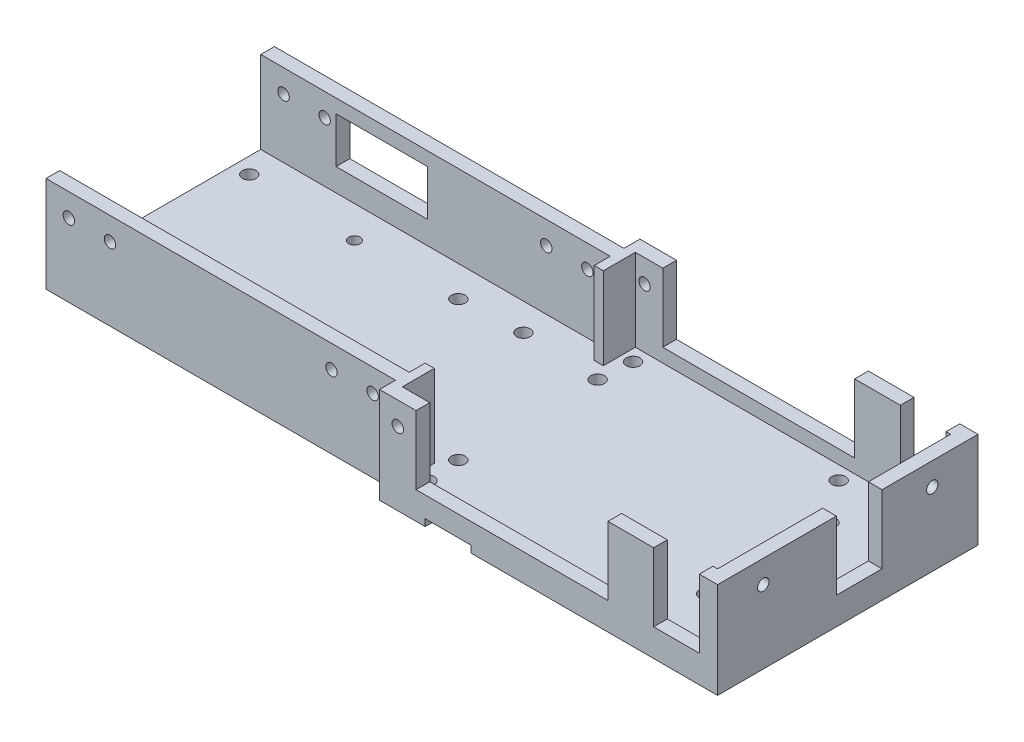
from build123d import *

# Parameters (mm, degrees)
SKETCH1_W           = 150.5
SKETCH1_H           = 50
BOSS_EXTRUDE1_DEPTH = 3
SKETCH2_R           = 1.5
SKETCH2_R_2         = 1.25
CUT_EXTRUDE1_DEPTH  = 119.536164414
SKETCH4_W           = 74
SKETCH4_H           = 3.5
BOSS_EXTRUDE2_DEPTH = 3
SKETCH5_R           = 1.5
CUT_EXTRUDE3_DEPTH  = 120.414015588
SKETCH6_W           = 10
SKETCH6_H           = 3
BOSS_EXTRUDE3_DEPTH = 18
SKETCH8_W           = 10
SKETCH8_H           = 3
SKETCH8_H_2         = 2
SKETCH8_W_2         = 42
SKETCH8_W_3         = 3
SKETCH8_H_3         = 10
BOSS_EXTRUDE4_DEPTH = 3
CUT_EXTRUDE4_REACH  = 130.67
SKETCH9_W           = 20
SKETCH9_H           = 10
CUT_EXTRUDE5_REACH  = 157.207
SKETCH10_R          = 1.25
SKETCH11_R          = 1.25
CUT_EXTRUDE6_DEPTH  = 129.67006369
SKETCH12_R          = 1.25
CUT_EXTRUDE7_DEPTH  = 131.164262722
SKETCH13_W          = 10
SKETCH13_H          = 1.5
CUT_EXTRUDE8_DEPTH  = 1.5


with BuildPart() as part:
    # Sketch1 → Boss-Extrude1 (new body)
    with BuildSketch(Plane(origin=(0, 0, 0), x_dir=(1, 0, 0), z_dir=(0, 1, 0))):
        with Locations((-39.87052506, -3.090692124)):
            Rectangle(SKETCH1_W, SKETCH1_H)
    extrude(amount=BOSS_EXTRUDE1_DEPTH)

    # Sketch2 → Cut-Extrude1 (cut, through all)
    with BuildSketch(Plane(origin=(0, 3, 0), x_dir=(1, 0, 0), z_dir=(0, 1, 0))):
        with Locations((-65.12052506, 12.159307876)):
            Circle(SKETCH2_R)
        with Locations((-65.12052506, -18.340692124)):
            Circle(SKETCH2_R)
        with Locations((-34.62052506, -18.340692124)):
            Circle(SKETCH2_R)
        with Locations((-34.62052506, 12.159307876)):
            Circle(SKETCH2_R)
        with Locations((17.87947494, -16.590692124)):
            Circle(SKETCH2_R)
        with Locations((17.87947494, 10.409307876)):
            Circle(SKETCH2_R)
        with Locations((-111.62052506, -19.090692124)):
            Circle(SKETCH2_R)
        with Locations((-111.62052506, 12.909307876)):
            Circle(SKETCH2_R)
        with Locations((-87.62052506, 11.909307876)):
            Circle(SKETCH2_R_2)
        with Locations((-87.62052506, -18.090692124)):
            Circle(SKETCH2_R_2)
        with Locations((-51.62052506, 12.909307876)):
            Circle(SKETCH2_R)
        with Locations((-51.62052506, -19.090692124)):
            Circle(SKETCH2_R)
    extrude(amount=-CUT_EXTRUDE1_DEPTH, mode=Mode.SUBTRACT)

    # Sketch4 → Boss-Extrude2 (add)
    with BuildSketch(Plane(origin=(0, 3, 0), x_dir=(1, 0, 0), z_dir=(0, 1, 0))):
        with Locations((-1.62052506, 23.659307876)):
            Rectangle(SKETCH4_W, SKETCH4_H)
        with Locations((-1.62052506, -29.840692124)):
            Rectangle(SKETCH4_W, SKETCH4_H)
    extrude(amount=-BOSS_EXTRUDE2_DEPTH)

    # Sketch5 → Cut-Extrude3 (cut, through all)
    with BuildSketch(Plane(origin=(0, 3, 0), x_dir=(1, 0, 0), z_dir=(0, 1, 0))):
        with Locations((-34.12052506, 19.409307876)):
            Circle(SKETCH5_R)
        with Locations((-34.12052506, -25.590692124)):
            Circle(SKETCH5_R)
        with Locations((10.87947494, 19.409307876)):
            Circle(SKETCH5_R)
        with Locations((10.87947494, -25.590692124)):
            Circle(SKETCH5_R)
    extrude(amount=-CUT_EXTRUDE3_DEPTH, mode=Mode.SUBTRACT)

    # Sketch6 → Boss-Extrude3 (add)
    with BuildSketch(Plane(origin=(0, 3, 0), x_dir=(1, 0, 0), z_dir=(0, 1, 0))):
        Polygon((35.37947494, -5.590692124), (32.37947494, -5.590692124), (32.37947494, -28.590692124), (31.37947494, -28.590692124), (31.37947494, -31.590692124), (35.37947494, -31.590692124), align=None)
        Polygon((35.37947494, 25.409307876), (31.37947494, 25.409307876), (31.37947494, 22.409307876), (32.37947494, 22.409307876), (32.37947494, 4.409307876), (35.37947494, 4.409307876), align=None)
        Polygon((-30.62052506, 22.409307876), (-30.62052506, 25.409307876), (-38.62052506, 25.409307876), (-38.62052506, 21.909307876), (-115.12052506, 21.909307876), (-115.12052506, 18.909307876), (-38.62052506, 18.909307876), (-38.62052506, 15.409307876), (-36.62052506, 15.409307876), (-36.62052506, 22.409307876), align=None)
        with Locations((16.37947494, 23.909307876)):
            Rectangle(SKETCH6_W, SKETCH6_H)
        Polygon((-36.62052506, -21.590692124), (-38.62052506, -21.590692124), (-38.62052506, -25.090692124), (-115.12052506, -25.090692124), (-115.12052506, -28.090692124), (-38.62052506, -28.090692124), (-38.62052506, -31.590692124), (-30.62052506, -31.590692124), (-30.62052506, -28.590692124), (-36.62052506, -28.590692124), align=None)
        with Locations((16.37947494, -30.090692124)):
            Rectangle(SKETCH6_W, SKETCH6_H)
    extrude(amount=BOSS_EXTRUDE3_DEPTH)

    # Sketch8 → Boss-Extrude4 (add)
    with BuildSketch(Plane(origin=(0, 3, 0), x_dir=(1, 0, 0), z_dir=(0, 1, 0))):
        with Locations((26.37947494, -30.090692124)):
            Rectangle(SKETCH8_W, SKETCH8_H)
        with Locations((26.37947494, 24.409307876)):
            Rectangle(SKETCH8_W, SKETCH8_H_2)
        with Locations((-9.62052506, 23.909307876)):
            Rectangle(SKETCH8_W_2, SKETCH8_H)
        with Locations((-9.62052506, -30.090692124)):
            Rectangle(SKETCH8_W_2, SKETCH8_H)
        with Locations((33.87947494, -0.590692124)):
            Rectangle(SKETCH8_W_3, SKETCH8_H_3)
    extrude(amount=BOSS_EXTRUDE4_DEPTH)

    # Sketch9 → Cut-Extrude4 (cut, up to next)
    with BuildSketch(Plane(origin=(0, 0, -21.909307876), x_dir=(-1, 0, 0), z_dir=(0, 0, -1)), mode=Mode.PRIVATE) as cut_extrude4_sk1:
        with Locations((88.62052506, 13)):
            Rectangle(SKETCH9_W, SKETCH9_H)
    cut_extrude4_tool1 = extrude(cut_extrude4_sk1.sketch, amount=-CUT_EXTRUDE4_REACH, mode=Mode.PRIVATE) & part.part
    add(cut_extrude4_tool1.solids().sort_by_distance((-88.620525, 13, -21.909308))[0], mode=Mode.SUBTRACT)

    # Sketch10 → Cut-Extrude5 (cut, up to next)
    with BuildSketch(Plane(origin=(35.37947494, 0, 0), x_dir=(0, 0, -1), z_dir=(1, 0, 0)), mode=Mode.PRIVATE) as cut_extrude5_sk1:
        with Locations((-21.590692124, 16)):
            Circle(SKETCH10_R)
    cut_extrude5_tool1 = extrude(cut_extrude5_sk1.sketch, amount=-CUT_EXTRUDE5_REACH, mode=Mode.PRIVATE) & part.part
    # Sketch10 → Cut-Extrude5 (cut, up to next)
    with BuildSketch(Plane(origin=(35.37947494, 0, 0), x_dir=(0, 0, -1), z_dir=(1, 0, 0)), mode=Mode.PRIVATE) as cut_extrude5_sk2:
        with Locations((15.409307876, 16)):
            Circle(SKETCH10_R)
    cut_extrude5_tool2 = extrude(cut_extrude5_sk2.sketch, amount=-CUT_EXTRUDE5_REACH, mode=Mode.PRIVATE) & part.part
    add(cut_extrude5_tool1.solids().sort_by_distance((35.379475, 16, 21.590692))[0], mode=Mode.SUBTRACT)
    add(cut_extrude5_tool2.solids().sort_by_distance((35.379475, 16, -15.409308))[0], mode=Mode.SUBTRACT)

    # Sketch11 → Cut-Extrude6 (cut, through all)
    with BuildSketch(Plane(origin=(0, 0, -21.909307876), x_dir=(-1, 0, 0), z_dir=(0, 0, -1))):
        with Locations((43.62052506, 16)):
            Circle(SKETCH11_R)
        with Locations((110.12052506, 16)):
            Circle(SKETCH11_R)
        with Locations((52.62052506, 16)):
            Circle(SKETCH11_R)
        with Locations((101.12052506, 16)):
            Circle(SKETCH11_R)
    extrude(amount=-CUT_EXTRUDE6_DEPTH, mode=Mode.SUBTRACT)

    # Sketch12 → Cut-Extrude7 (cut, through all)
    with BuildSketch(Plane(origin=(0, 0, -25.409307876), x_dir=(-1, 0, 0), z_dir=(0, 0, -1))):
        with Locations((34.62052506, 16)):
            Circle(SKETCH12_R)
    extrude(amount=-CUT_EXTRUDE7_DEPTH, mode=Mode.SUBTRACT)

    # Sketch13 → Cut-Extrude8 (cut)
    with BuildSketch(Plane(origin=(0, 0, 0), x_dir=(-1, 0, 0), z_dir=(0, -1, 0))):
        with Locations((23.62052506, -30.840692124)):
            Rectangle(SKETCH13_W, SKETCH13_H)
        with Locations((23.62052506, 24.659307876)):
            Rectangle(SKETCH13_W, SKETCH13_H)
    extrude(amount=-CUT_EXTRUDE8_DEPTH, mode=Mode.SUBTRACT)


solid = part.part
